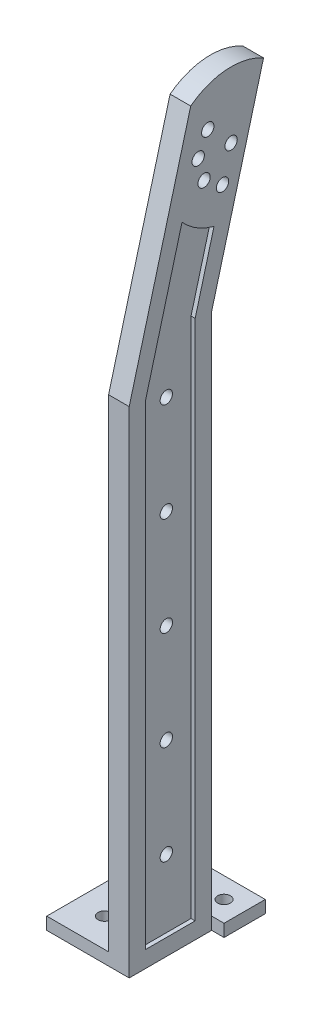
from build123d import *

# Parameters (mm, degrees)
SKETCH_1_R          = 1.5
EXTRUDE_2_DEPTH     = 5
CUT_EXTRUDE_1_DEPTH = 1
EXTRUDE_3_DEPTH     = 3
SKETCH_6_R          = 1.55
CUT_EXTRUDE_2_DEPTH = 10
SKETCH_7_W          = 3
SKETCH_7_H          = 41
EXTRUDE_4_DEPTH     = 13
EXTRUDE_5_DEPTH     = 3
SKETCH_11_R         = 1.5
CUT_EXTRUDE_4_DEPTH = 181.916806655


with BuildPart() as part:
    # 草图1 → 凸台-拉伸2 (new body)
    with BuildSketch(Plane(origin=(0, 0, 0), x_dir=(0, 0, -1), z_dir=(1, 0, 0))):
        with BuildLine():
            Line((-10, 0), (10, 0))
            Line((10, 0), (10, 130))
            Line((10, 130), (22.580255424, 176.950152413))
            ThreePointArc((22.580255424, 176.950152413), (13.557589865, 178.980034876), (4.918920693, 175.678170019))
            Line((4.918920693, 175.678170019), (-10, 120))
            Line((-10, 120), (-10, 0))
        make_face()
        with Locations((0, 116.48228672)):
            Circle(SKETCH_1_R, mode=Mode.SUBTRACT)
        with Locations((14.706944713, 163.021370038)):
            Circle(SKETCH_1_R, mode=Mode.SUBTRACT)
        with Locations((12.636392352, 155.293963427)):
            Circle(SKETCH_1_R, mode=Mode.SUBTRACT)
        with Locations((0, 92.48228672)):
            Circle(SKETCH_1_R, mode=Mode.SUBTRACT)
        with Locations((0, 68.48228672)):
            Circle(SKETCH_1_R, mode=Mode.SUBTRACT)
        with Locations((0, 44.48228672)):
            Circle(SKETCH_1_R, mode=Mode.SUBTRACT)
        with Locations((0, 20.48228672)):
            Circle(SKETCH_1_R, mode=Mode.SUBTRACT)
        with Locations((8.153728359, 158.432758547)):
            Circle(SKETCH_1_R, mode=Mode.SUBTRACT)
        with Locations((6.737387128, 163.71861598)):
            Circle(SKETCH_1_R, mode=Mode.SUBTRACT)
        with Locations((9.050090463, 168.678224287)):
            Circle(SKETCH_1_R, mode=Mode.SUBTRACT)
    extrude(amount=-EXTRUDE_2_DEPTH)

    # 草图4 → 切除-拉伸1 (cut)
    with BuildSketch(Plane(origin=(0, 0, 0), x_dir=(0, 0, -1), z_dir=(1, 0, 0))):
        with BuildLine():
            Line((2.803784521, 152.329561142), (-6, 119.47339001))
            Line((-6, 119.47339001), (-6, 4))
            Line((-6, 4), (6, 4))
            Line((6, 4), (6, 130.52660999))
            Line((6, 130.52660999), (10.565839991, 147.566556817))
            ThreePointArc((10.565839991, 147.566556817), (6.338781133, 149.384147509), (2.803784521, 152.329561142))
        make_face()
    extrude(amount=-CUT_EXTRUDE_1_DEPTH, mode=Mode.SUBTRACT)

    # 草图5 → 凸台-拉伸3 (add)
    with BuildSketch(Plane(origin=(0, 0, 0), x_dir=(-1, 0, 0), z_dir=(0, -1, 0))):
        Polygon((0, -10), (20, -10), (20, 10), (20, 20), (-3, 20), (-3, 10), (0, 10), align=None)
    extrude(amount=-EXTRUDE_3_DEPTH)

    # 草图6 → 切除-拉伸2 (cut)
    with BuildSketch(Plane.XZ):
        with Locations((-13, 3)):
            Circle(SKETCH_6_R)
        with Locations((-2, -15)):
            Circle(SKETCH_6_R)
        with Locations((-13, -11)):
            Circle(SKETCH_6_R)
    extrude(amount=-CUT_EXTRUDE_2_DEPTH, mode=Mode.SUBTRACT)

    # 草图7 → 凸台-拉伸4 (add)
    with BuildSketch(Plane.ZY.offset(5)):
        with Locations((-5.3, 23.5)):
            Rectangle(SKETCH_7_W, SKETCH_7_H)
    extrude(amount=EXTRUDE_4_DEPTH)

    # 草图9 → 凸台-拉伸5 (add)
    with BuildSketch(Plane(origin=(0, 0, -6.8), x_dir=(-1, 0, 0), z_dir=(0, 0, -1))):
        with BuildLine():
            Line((5, 44), (18, 44))
            ThreePointArc((18, 44), (11.5, 50.5), (5, 44))
        make_face()
    extrude(amount=-EXTRUDE_5_DEPTH)

    # 草图11 → 切除-拉伸4 (cut, through all)
    with BuildSketch(Plane(origin=(0, 0, -6.8), x_dir=(-1, 0, 0), z_dir=(0, 0, -1))):
        with Locations((11.5, 44)):
            Circle(SKETCH_11_R)
        with Locations((11.5, 7)):
            Circle(SKETCH_11_R)
    extrude(amount=-CUT_EXTRUDE_4_DEPTH, mode=Mode.SUBTRACT)


solid = part.part
